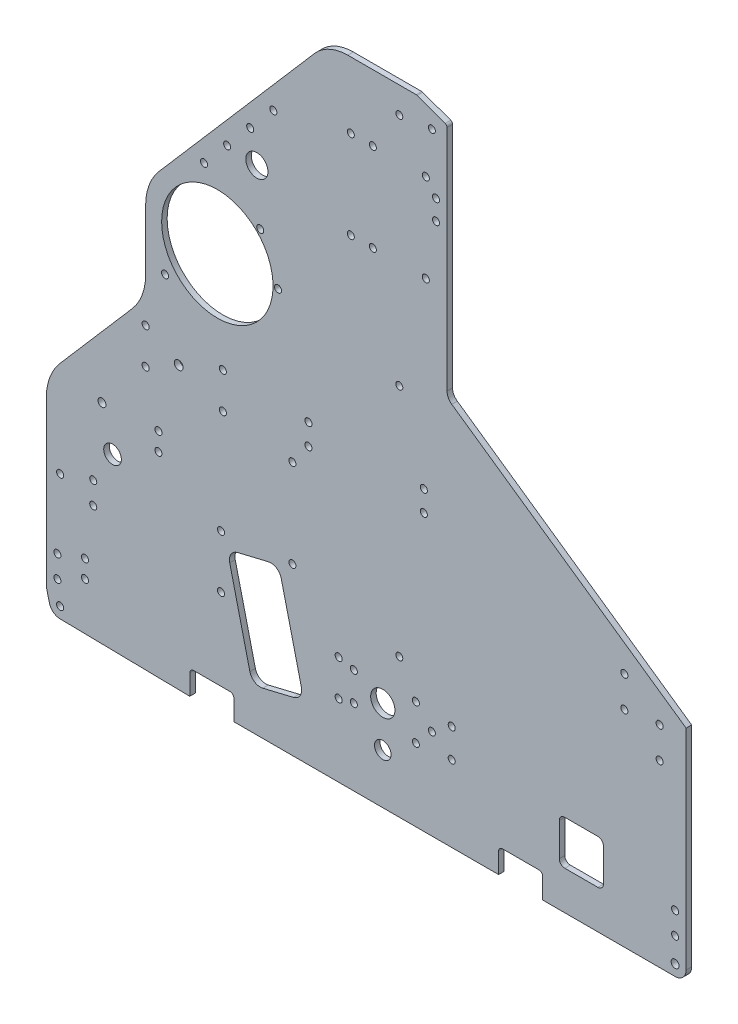
from build123d import *

# Parameters (mm, degrees)
SKETCH1_R           = 2.032
SKETCH1_R_2         = 5.08
SKETCH1_R_3         = 2.54
SKETCH1_R_4         = 2
BOSS_EXTRUDE1_DEPTH = 3.175
FILLET1_R           = 2.286
FILLET2_R           = 6.35
SKETCH2_R           = 2.032
CUT_EXTRUDE1_DEPTH  = 505.524983177
FILLET3_R           = 1.5875
SKETCH3_R           = 2.032
SKETCH3_R_2         = 2.286
CUT_EXTRUDE2_DEPTH  = 505.524983177
SKETCH4_R           = 2.032
SKETCH4_R_2         = 6.985
SKETCH4_R_3         = 4.7625
CUT_EXTRUDE3_DEPTH  = 505.524983177
SKETCH5_R           = 32.0675
SKETCH5_R_2         = 2.286000001
CUT_EXTRUDE5_DEPTH  = 505.524983177
FILLET4_R           = 31.75
CUT_EXTRUDE6_DEPTH  = 505.524983177
FILLET5_R           = 25.4
SKETCH8_R           = 2.031999999
SKETCH8_R_2         = 2.032
CUT_EXTRUDE7_DEPTH  = 505.524983177
SKETCH10_R          = 2.031999999
CUT_EXTRUDE8_DEPTH  = 505.524983177
FILLET6_R           = 6.35
SKETCH11_RX         = 2.032
SKETCH11_RY         = 2.031999502
CUT_EXTRUDE9_DEPTH  = 505.524983177
SKETCH12_R          = 6.375981846
CUT_EXTRUDE10_DEPTH = 505.524983319


with BuildPart() as part:
    # Sketch1 → Boss-Extrude1 (new body)
    with BuildSketch(Plane.XY):
        with BuildLine():
            Line((7.829508682, -19.049081656), (82.55, -20.32))
            Line((82.55, -20.32), (82.55, -6.35))
            Line((82.55, -6.35), (107.95, -6.35))
            Line((107.95, -6.35), (107.95, -20.32))
            Line((107.95, -20.32), (260.35, -20.32))
            Line((260.35, -20.32), (260.35, -6.35))
            Line((260.35, -6.35), (285.75, -6.35))
            Line((285.75, -6.35), (285.75, -20.32))
            Line((285.75, -20.32), (368.3, -20.32))
            Line((368.3, -20.32), (368.3, 106.68))
            Line((368.3, 106.68), (230.66375, 202.565))
            Line((230.66375, 202.565), (230.66375, 338.455))
            Line((230.66375, 338.455), (213.19998, 344.805))
            Line((213.19998, 344.805), (203.2, 344.805))
            Line((203.2, 344.805), (161.925, 344.805))
            Line((161.925, 344.805), (52.720122664, 218.469945827))
            ThreePointArc((52.720122664, 218.469945827), (52.803835479, 218.142145922), (52.832, 217.805))
            ThreePointArc((52.832, 217.805), (52.095493096, 216.239521914), (50.419872403, 215.808871996))
            Line((50.419872403, 215.808871996), (0, 157.48))
            Line((0, 157.48), (0, 0))
            Line((0, 0), (0, -6.35))
            ThreePointArc((0, -6.35), (0.047577015, -7.125863724), (0.189595124, -7.890101219))
            Line((0.189595124, -7.890101219), (1.777095124, -14.240101219))
            ThreePointArc((1.777095124, -14.240101219), (3.987212552, -17.671692778), (7.829508682, -19.049081656))
        make_face()
        with Locations((7.9375, -12.7)):
            Circle(SKETCH1_R, mode=Mode.SUBTRACT)
        with Locations((6.35, 0)):
            Circle(SKETCH1_R, mode=Mode.SUBTRACT)
        with Locations((6.35, 12.7)):
            Circle(SKETCH1_R, mode=Mode.SUBTRACT)
        with Locations((38.1, 78.105)):
            Circle(SKETCH1_R_2, mode=Mode.SUBTRACT)
        with Locations((57.15, 131.28625)):
            Circle(SKETCH1_R, mode=Mode.SUBTRACT)
        with Locations((57.15, 151.92375)):
            Circle(SKETCH1_R, mode=Mode.SUBTRACT)
        with Locations((76.2, 141.605)):
            Circle(SKETCH1_R_3, mode=Mode.SUBTRACT)
        with Locations((101.6, 131.28625)):
            Circle(SKETCH1_R, mode=Mode.SUBTRACT)
        with Locations((101.6, 151.92375)):
            Circle(SKETCH1_R, mode=Mode.SUBTRACT)
        with Locations((203.2, 59.805)):
            Circle(SKETCH1_R_4, mode=Mode.SUBTRACT)
        with Locations((361.95, 0)):
            Circle(SKETCH1_R, mode=Mode.SUBTRACT)
        with Locations((361.95, 12.7)):
            Circle(SKETCH1_R, mode=Mode.SUBTRACT)
        with Locations((353.06, 82.955052336)):
            Circle(SKETCH1_R, mode=Mode.SUBTRACT)
        with Locations((332.74, 98.195052336)):
            Circle(SKETCH1_R, mode=Mode.SUBTRACT)
        with Locations((332.74, 115.975052336)):
            Circle(SKETCH1_R, mode=Mode.SUBTRACT)
        with Locations((353.06, 100.735052336)):
            Circle(SKETCH1_R, mode=Mode.SUBTRACT)
        with Locations((68.326, 182.923674932)):
            Circle(SKETCH1_R, mode=Mode.SUBTRACT)
        with Locations((76.2, 217.805)):
            Circle(SKETCH1_R, mode=Mode.SUBTRACT)
        with Locations((90.779500502, 249.682)):
            Circle(SKETCH1_R, mode=Mode.SUBTRACT)
        with Locations((104.067838673, 265.054783374)):
            Circle(SKETCH1_R, mode=Mode.SUBTRACT)
        with Locations((117.356176844, 280.427566748)):
            Circle(SKETCH1_R, mode=Mode.SUBTRACT)
        with Locations((130.644515014, 295.800350122)):
            Circle(SKETCH1_R, mode=Mode.SUBTRACT)
        with Locations((203.2, 194.805)):
            Circle(SKETCH1_R_4, mode=Mode.SUBTRACT)
        with Locations((224.31375, 287.401)):
            Circle(SKETCH1_R, mode=Mode.SUBTRACT)
        with Locations((224.31375, 298.831)):
            Circle(SKETCH1_R, mode=Mode.SUBTRACT)
        with Locations((203.2, 329.805)):
            Circle(SKETCH1_R_4, mode=Mode.SUBTRACT)
        with Locations((221.931865, 332.105)):
            Circle(SKETCH1_R_4, mode=Mode.SUBTRACT)
    extrude(amount=BOSS_EXTRUDE1_DEPTH)

    # Fillet1
    fillet1_edges = [part.edges().sort_by_distance(p)[0] for p in [
        (285.75, -6.35, 1.5875),
        (107.95, -6.35, 1.5875),
        (260.35, -6.35, 1.5875),
        (82.55, -6.35, 1.5875),
    ]]
    fillet(fillet1_edges, radius=FILLET1_R)

    # Fillet2
    fillet2_edges = [part.edges().sort_by_distance(p)[0] for p in [
        (230.66375, 202.565, 1.5875),
    ]]
    fillet(fillet2_edges, radius=FILLET2_R)

    # Sketch2 → Cut-Extrude1 (cut, through all)
    with BuildSketch(Plane(origin=(0, 0, 0), x_dir=(-1, 0, 0), z_dir=(0, 0, -1))):
        with Locations((-100.552770272, 71.086035298)):
            Circle(SKETCH2_R)
        with Locations((-100.552770272, 40.606035298)):
            Circle(SKETCH2_R)
        with Locations((-22.225, 18.202541089)):
            Circle(SKETCH2_R)
        with Locations((-22.225, 8.042541089)):
            Circle(SKETCH2_R)
    extrude(amount=-CUT_EXTRUDE1_DEPTH, mode=Mode.SUBTRACT)

    # Fillet3
    fillet3_edges = [part.edges().sort_by_distance(p)[0] for p in [
        (230.66375, 338.455, 1.5875),
        (213.19998, 344.805, 1.5875),
    ]]
    fillet(fillet3_edges, radius=FILLET3_R)

    # Sketch3 → Cut-Extrude2 (cut, through all)
    with BuildSketch(Plane.XY.offset(3.175)):
        with BuildLine():
            Line((127.789350211, 69.359774106), (110.09075034, 65.117184968))
            ThreePointArc((110.09075034, 65.117184968), (106.287939856, 62.356288953), (105.55119507, 57.715047577))
            Line((105.55119507, 57.715047577), (117.160037875, 9.287010566))
            ThreePointArc((117.160037875, 9.287010566), (119.920933891, 5.484200083), (124.562175266, 4.747455297))
            Line((124.562175266, 4.747455297), (142.260775137, 8.990044434))
            ThreePointArc((142.260775137, 8.990044434), (146.063585621, 11.75094045), (146.800330407, 16.392181825))
            Line((146.800330407, 16.392181825), (135.191487602, 64.820218836))
            ThreePointArc((135.191487602, 64.820218836), (132.430591586, 68.62302932), (127.789350211, 69.359774106))
        make_face()
        with Locations((26.987500002, 46.953113935)):
            Circle(SKETCH3_R)
        with Locations((26.987500002, 59.653113935)):
            Circle(SKETCH3_R)
        with Locations((7.937500002, 53.303113935)):
            Circle(SKETCH3_R)
        with Locations((32.030600738, 100.810868776)):
            Circle(SKETCH3_R_2)
        with Locations((64.525942114, 102.94048958)):
            Circle(SKETCH3_R)
        with Locations((64.525942114, 92.525786339)):
            Circle(SKETCH3_R)
        with Locations((133.35, 208.228121768)):
            Circle(SKETCH3_R)
        with Locations((123.120704333, 232.923826101)):
            Circle(SKETCH3_R)
    extrude(amount=-CUT_EXTRUDE2_DEPTH, mode=Mode.SUBTRACT)

    # Sketch4 → Cut-Extrude3 (cut, through all)
    with BuildSketch(Plane.XY.offset(3.175)):
        with Locations((168.275, 42.06875)):
            Circle(SKETCH4_R)
        with Locations((212.725, 42.06875)):
            Circle(SKETCH4_R)
        with Locations((212.725, 21.43125)):
            Circle(SKETCH4_R)
        with Locations((168.275, 21.43125)):
            Circle(SKETCH4_R)
        with Locations((193.675, 31.75)):
            Circle(SKETCH4_R_2)
        with Locations((177.00498, 40.0431)):
            Circle(SKETCH4_R)
        with Locations((177.00498, 23.4569)):
            Circle(SKETCH4_R)
        with Locations((193.675, 8.466666658)):
            Circle(SKETCH4_R_3)
        with Locations((221.931865, 31.75)):
            Circle(SKETCH4_R)
        with Locations((233.36123, 23.4569)):
            Circle(SKETCH4_R)
        with Locations((233.36123, 40.0431)):
            Circle(SKETCH4_R)
    extrude(amount=-CUT_EXTRUDE3_DEPTH, mode=Mode.SUBTRACT)

    # Sketch5 → Cut-Extrude5 (cut, through all)
    with BuildSketch(Plane(origin=(0, 0, 0), x_dir=(-1, 0, 0), z_dir=(0, 0, -1))):
        Polygon((0, 157.48), (-57.15, 223.594705882), (-57.15, 165.333696112), (0, 99.218990229), align=None)
        with Locations((-98.425, 208.228121768)):
            Circle(SKETCH5_R)
        with Locations((-361.95, -13.97)):
            Circle(SKETCH5_R_2)
    extrude(amount=-CUT_EXTRUDE5_DEPTH, mode=Mode.SUBTRACT)

    # Fillet4
    fillet4_edges = [part.edges().sort_by_distance(p)[0] for p in [
        (0, 99.218990229, 1.5875),
        (57.15, 165.333696112, 1.5875),
        (57.15, 223.594705882, 1.5875),
    ]]
    fillet(fillet4_edges, radius=FILLET4_R)

    # Sketch6 → Cut-Extrude6 (cut, through all)
    with BuildSketch(Plane.XY.offset(3.175)):
        with BuildLine():
            Line((298.45, 27.305), (317.5, 27.305))
            ThreePointArc((317.5, 27.305), (319.74506403, 26.37506403), (320.675, 24.13))
            Line((320.675, 24.13), (320.675, 5.08))
            ThreePointArc((320.675, 5.08), (319.74506403, 2.83493597), (317.5, 1.905))
            Line((317.5, 1.905), (298.45, 1.905))
            ThreePointArc((298.45, 1.905), (296.20493597, 2.83493597), (295.275, 5.08))
            Line((295.275, 5.08), (295.275, 24.13))
            ThreePointArc((295.275, 24.13), (296.20493597, 26.37506403), (298.45, 27.305))
        make_face()
    extrude(amount=-CUT_EXTRUDE6_DEPTH, mode=Mode.SUBTRACT)

    # Fillet5
    fillet5_edges = [part.edges().sort_by_distance(p)[0] for p in [
        (161.925, 344.805, 1.5875),
    ]]
    fillet(fillet5_edges, radius=FILLET5_R)

    # Sketch8 → Cut-Extrude7 (cut, through all)
    with BuildSketch(Plane(origin=(0, 0, 0), x_dir=(-1, 0, 0), z_dir=(0, 0, -1))):
        with Locations((-187.96, 306.70500001)):
            Circle(SKETCH8_R)
        with Locations((-175.26, 306.70500001)):
            Circle(SKETCH8_R_2)
        with Locations((-218.44, 306.704999997)):
            Circle(SKETCH8_R_2)
        with Locations((-218.44, 255.904999997)):
            Circle(SKETCH8_R_2)
        with Locations((-187.96, 255.90500001)):
            Circle(SKETCH8_R)
        with Locations((-175.26, 255.90500001)):
            Circle(SKETCH8_R_2)
    extrude(amount=-CUT_EXTRUDE7_DEPTH, mode=Mode.SUBTRACT)

    # Sketch10 → Cut-Extrude8 (cut, through all)
    with BuildSketch(Plane.XY.offset(3.175)):
        with Locations((141.642480002, 75.160621768)):
            Circle(SKETCH10_R)
        with Locations((141.642480002, 125.960621768)):
            Circle(SKETCH10_R)
    extrude(amount=-CUT_EXTRUDE8_DEPTH, mode=Mode.SUBTRACT)

    # Fillet6
    fillet6_edges = [part.edges().sort_by_distance(p)[0] for p in [
        (368.3, -20.32, 1.5875),
    ]]
    fillet(fillet6_edges, radius=FILLET6_R)

    # Sketch11 → Cut-Extrude9 (cut, through all)
    with BuildSketch(Plane.XY.offset(3.175)):
        with Locations(Location((150.881424454, 138.43), (0, 0, 90))):
            Ellipse(SKETCH11_RX, SKETCH11_RY)
        with Locations(Location((150.881424454, 150.495), (0, 0, 90))):
            Ellipse(SKETCH11_RX, SKETCH11_RY)
        with Locations(Location((217.30240818, 150.495), (0, 0, 90))):
            Ellipse(SKETCH11_RX, SKETCH11_RY)
        with Locations(Location((217.30240818, 138.43), (0, 0, 90))):
            Ellipse(SKETCH11_RX, SKETCH11_RY)
    extrude(amount=-CUT_EXTRUDE9_DEPTH, mode=Mode.SUBTRACT)

    # Sketch12 → Cut-Extrude10 (cut, through all)
    with BuildSketch(Plane.XY.offset(3.175)):
        with Locations((121.184716432, 263.688494682)):
            Circle(SKETCH12_R)
    extrude(amount=-CUT_EXTRUDE10_DEPTH, mode=Mode.SUBTRACT)


solid = part.part
